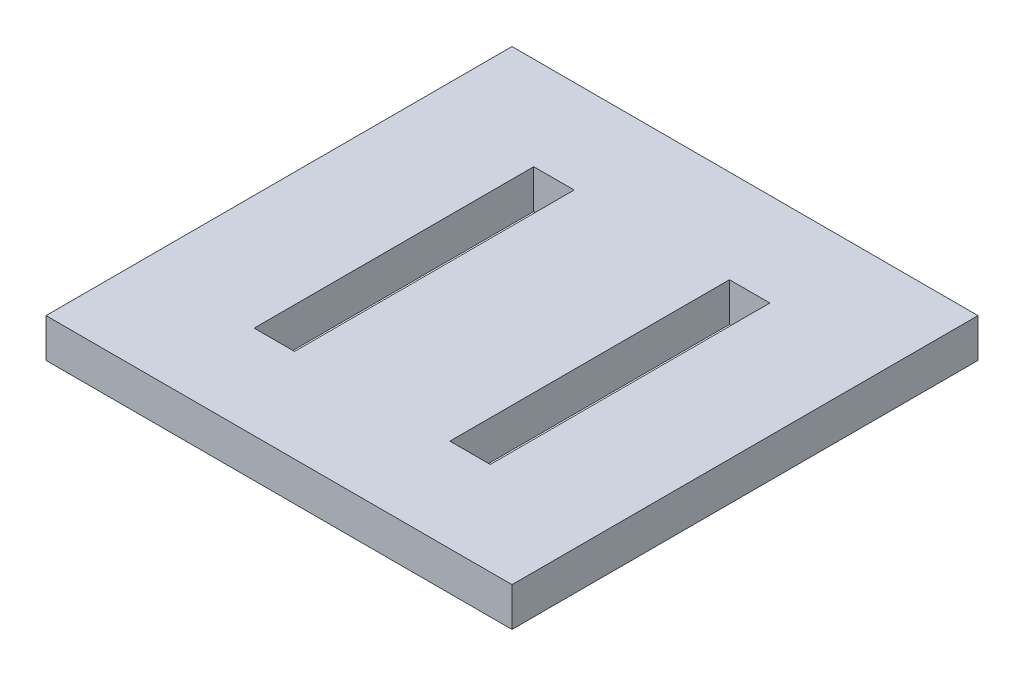
from build123d import *

# Parameters (mm, degrees)
SKETCH1_W           = 76.2
SKETCH1_H           = 76.2
BOSS_EXTRUDE1_DEPTH = 6.35
SKETCH2_W           = 6.604
SKETCH2_H           = 45.72
CUT_EXTRUDE1_DEPTH  = 55.254423783


with BuildPart() as part:
    # Sketch1 → Boss-Extrude1 (new body)
    with BuildSketch(Plane(origin=(0, 0, 0), x_dir=(1, 0, 0), z_dir=(0, 1, 0))):
        Rectangle(SKETCH1_W, SKETCH1_H)
    extrude(amount=BOSS_EXTRUDE1_DEPTH)

    # Sketch2 → Cut-Extrude1 (cut, through all)
    with BuildSketch(Plane(origin=(0, 0, 0), x_dir=(1, 0, 0), z_dir=(0, 1, 0))):
        with Locations((16.002, 0)):
            Rectangle(SKETCH2_W, SKETCH2_H)
        with Locations((-16.002, 0)):
            Rectangle(SKETCH2_W, SKETCH2_H)
    extrude(amount=CUT_EXTRUDE1_DEPTH, mode=Mode.SUBTRACT)


solid = part.part
